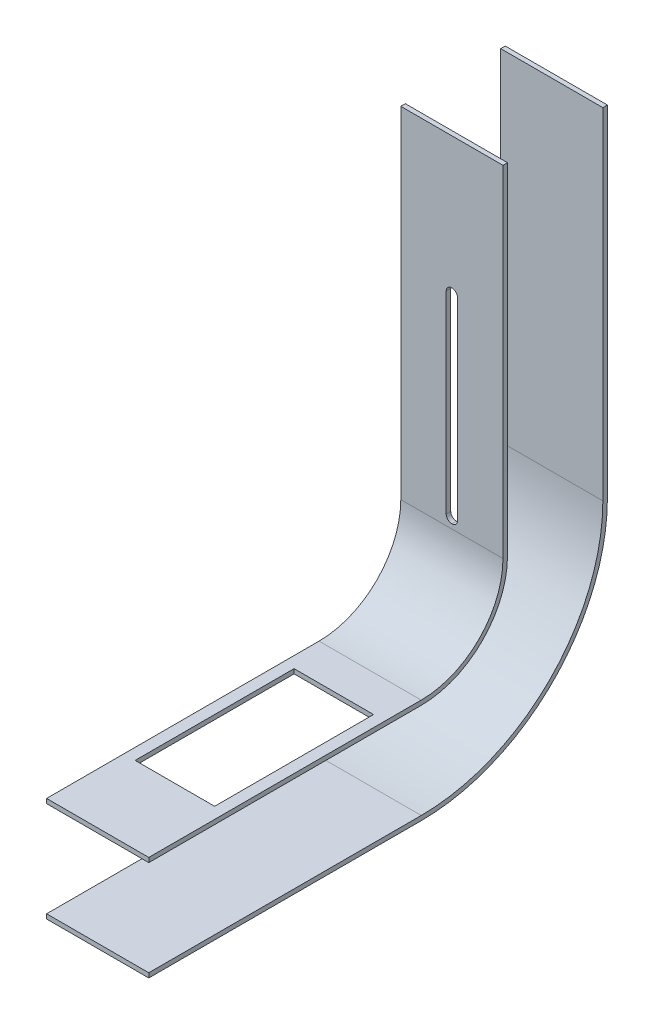
from build123d import *

# Parameters (mm, degrees)
BOSS_EXTRUDE1_DEPTH   = 45
BOSS_EXTRUDE1_2_DEPTH = 45
SKETCH2_W             = 5
SKETCH2_H             = 90
CUT_EXTRUDE1_DEPTH    = 5
SKETCH3_W             = 35
SKETCH3_H             = 70
CUT_EXTRUDE2_DEPTH    = 5
FILLET1_R             = 2.5


with BuildPart() as part:
    # Sketch1 → Boss-Extrude1 (new body)
    with BuildSketch(Plane(origin=(0, 0, 0), x_dir=(0, 0, -1), z_dir=(1, 0, 0))):
        with BuildLine():
            Line((0, -38), (-120, -38))
            Line((-120, -38), (-120, -36))
            Line((-120, -36), (0, -36))
            ThreePointArc((0, -36), (25.455844123, -25.455844123), (36, 0))
            Line((36, 0), (36, 150))
            Line((36, 150), (38, 150))
            Line((38, 150), (38, 0))
            ThreePointArc((38, 0), (26.870057685, -26.870057685), (0, -38))
        make_face()
    extrude(amount=BOSS_EXTRUDE1_DEPTH)

    # Sketch2 → Cut-Extrude1 (cut)
    with BuildSketch(Plane.XY.offset(-36)):
        with Locations((22.5, 47)):
            Rectangle(SKETCH2_W, SKETCH2_H)
    extrude(amount=-CUT_EXTRUDE1_DEPTH, mode=Mode.SUBTRACT)

    # Sketch3 → Cut-Extrude2 (cut)
    with BuildSketch(Plane(origin=(0, -36, 0), x_dir=(1, 0, 0), z_dir=(0, 1, 0))):
        with Locations((22.5, -51)):
            Rectangle(SKETCH3_W, SKETCH3_H)
    extrude(amount=-CUT_EXTRUDE2_DEPTH, mode=Mode.SUBTRACT)

    # Fillet1
    fillet1_edges = [part.edges().sort_by_distance(p)[0] for p in [
        (25, 92, -37),
        (20, 92, -37),
        (25, 2, -37),
        (20, 2, -37),
    ]]
    fillet(fillet1_edges, radius=FILLET1_R - 0.0001)  # a hair under: the kernel refuses the full size


with BuildPart() as body_2:
    # Sketch1 → Boss-Extrude1 2 (new body)
    with BuildSketch(Plane(origin=(0, 0, 0), x_dir=(0, 0, -1), z_dir=(1, 0, 0))):
        with BuildLine():
            Line((-120, -80), (0, -80))
            ThreePointArc((0, -80), (56.568542495, -56.568542495), (80, 0))
            Line((80, 0), (80, 150))
            Line((80, 150), (82, 150))
            Line((82, 150), (82, 0))
            ThreePointArc((82, 0), (57.982756057, -57.982756057), (0, -82))
            Line((0, -82), (-120, -82))
            Line((-120, -82), (-120, -80))
        make_face()
    extrude(amount=BOSS_EXTRUDE1_2_DEPTH)


solid = Compound([part.part, body_2.part])
